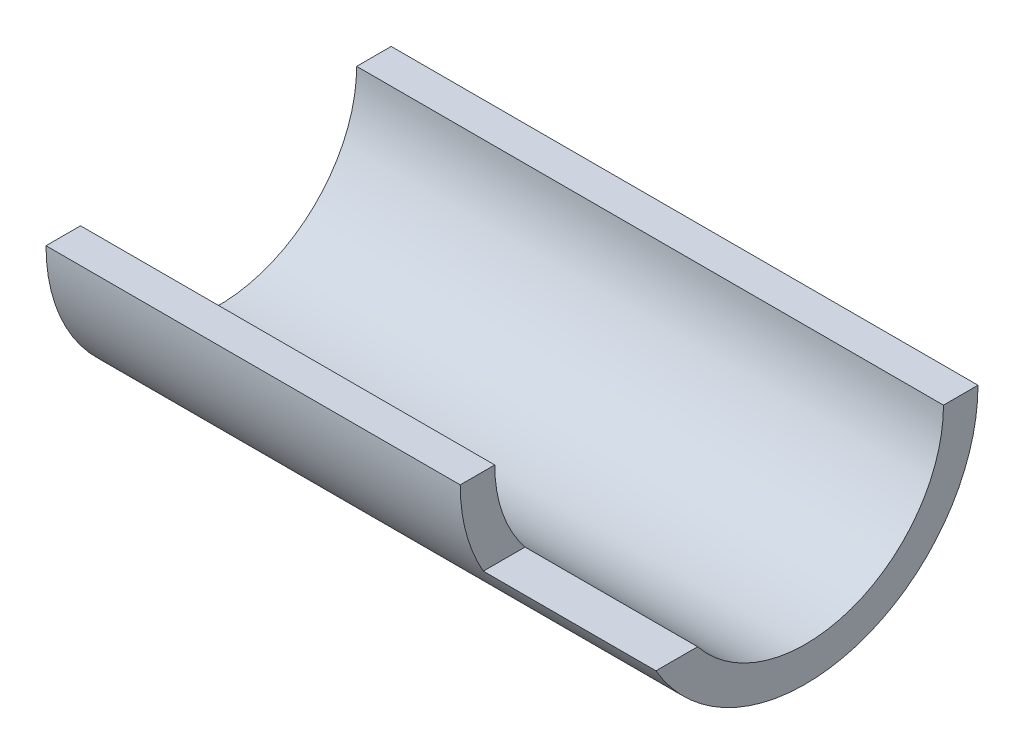
from build123d import *

# Parameters (mm, degrees)
BOSS_EXTRUDE1_DEPTH = 107.95
SKETCH2_W           = 31.75
SKETCH2_H           = 15.875
CUT_EXTRUDE1_DEPTH  = 127


with BuildPart() as part:
    # Sketch1 → Boss-Extrude1 (new body)
    with BuildSketch(Plane(origin=(0, 0, 0), x_dir=(0, 0, -1), z_dir=(1, 0, 0))):
        with BuildLine():
            Line((-25.4, 0), (-31.75, 0))
            ThreePointArc((-31.75, 0), (0, -31.75), (31.75, 0))
            Line((31.75, 0), (25.4, 0))
            ThreePointArc((25.4, 0), (0, -25.4), (-25.4, 0))
        make_face()
    extrude(amount=-BOSS_EXTRUDE1_DEPTH)

    # Sketch2 → Cut-Extrude1 (cut)
    with BuildSketch(Plane.XY):
        with Locations((-15.875, -7.9375)):
            Rectangle(SKETCH2_W, SKETCH2_H)
    extrude(amount=CUT_EXTRUDE1_DEPTH, mode=Mode.SUBTRACT)


solid = part.part
